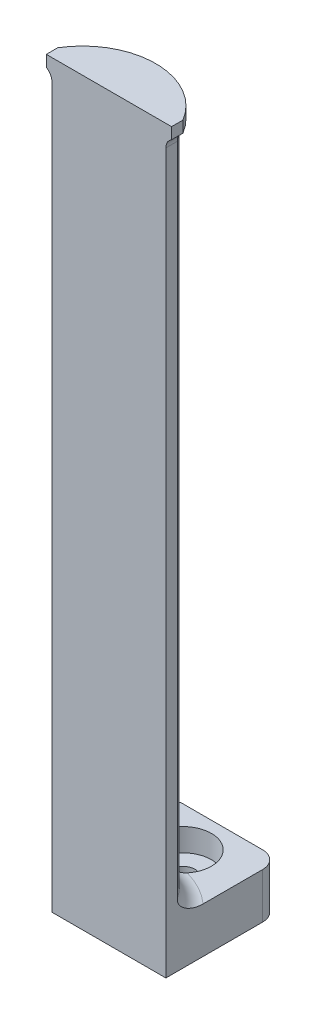
from build123d import *

# Parameters (mm, degrees)
BOSS_EXTRU_1_DEPTH           = 120
ESQUISSE3_W                  = 20
ESQUISSE3_H                  = 18
BOSS_EXTRU_2_DEPTH           = 8
CONG_1_R                     = 3
CONG_2_R                     = 3
ENL_V_MAT_EXTRU_1_DEPTH      = 122.75385005
ENL_V_MAT_EXTRU_1_DEPTH_BACK = 122.75385005
ESQUISSE4_R                  = 2.1
ENL_V_MAT_EXTRU_2_DEPTH      = 122.75385005
ENL_V_MAT_EXTRU_2_DEPTH_BACK = 4
ESQUISSE5_R                  = 5
ESQUISSE7_W                  = 20
ESQUISSE7_H                  = 128
BOSS_EXTRU_3_DEPTH           = 2
BOSS_EXTRU_4_DEPTH           = 2
CONG_3_R                     = 2


with BuildPart() as part:
    # Esquisse2 → Boss.-Extru.1 (new body)
    with BuildSketch(Plane(origin=(0, 0, 0), x_dir=(1, 0, 0), z_dir=(0, 1, 0))):
        with BuildLine():
            Line((-10, 0), (10, 0))
            ThreePointArc((10, 0), (0, 5.366750419), (-10, 0))
        make_face()
    extrude(amount=BOSS_EXTRU_1_DEPTH)

    # Esquisse3 → Boss.-Extru.2 (add)
    with BuildSketch(Plane.XZ):
        with Locations((0, -9)):
            Rectangle(ESQUISSE3_W, ESQUISSE3_H)
    extrude(amount=BOSS_EXTRU_2_DEPTH)

    # Congé1
    cong_1_edges = [part.edges().sort_by_distance(p)[0] for p in [
        (0, 0, -5.366750419),
    ]]
    fillet(cong_1_edges, radius=CONG_1_R)

    # Congé2
    cong_2_edges = [part.edges().sort_by_distance(p)[0] for p in [
        (10, -4, -18),
        (-10, -4, -18),
    ]]
    fillet(cong_2_edges, radius=CONG_2_R)

    # Esquisse4 → Enlèv. mat.-Extru.1 (cut, two sides: drawn at the far end of the back side and taken through both)
    with BuildSketch(Plane(origin=(0, 0, 0), x_dir=(1, 0, 0), z_dir=(0, 1, 0)).offset(-ENL_V_MAT_EXTRU_1_DEPTH_BACK)):
        with Locations(Location((0, 11, 0), (0, 0, 270))):
            Circle(ESQUISSE4_R)
    extrude(amount=ENL_V_MAT_EXTRU_1_DEPTH + ENL_V_MAT_EXTRU_1_DEPTH_BACK, mode=Mode.SUBTRACT)

    # Esquisse5 → Enlèv. mat.-Extru.2 (cut, two sides: drawn at the far end of the back side and taken through both)
    with BuildSketch(Plane(origin=(0, 0, 0), x_dir=(1, 0, 0), z_dir=(0, 1, 0)).offset(-ENL_V_MAT_EXTRU_2_DEPTH_BACK)):
        with Locations(Location((0, 11, 0), (0, 0, 270))):
            Circle(ESQUISSE5_R)
    extrude(amount=ENL_V_MAT_EXTRU_2_DEPTH + ENL_V_MAT_EXTRU_2_DEPTH_BACK, mode=Mode.SUBTRACT)

    # Esquisse7 → Boss.-Extru.3 (add)
    with BuildSketch(Plane.XY):
        with Locations((0, 56)):
            Rectangle(ESQUISSE7_W, ESQUISSE7_H)
    extrude(amount=BOSS_EXTRU_3_DEPTH)

    # Esquisse8 → Boss.-Extru.4 (add)
    with BuildSketch(Plane(origin=(0, 120, 0), x_dir=(1, 0, 0), z_dir=(0, 1, 0))):
        with BuildLine():
            Line((-11, -2), (11, -2))
            Line((11, -2), (11, 0))
            ThreePointArc((11, 0), (0, 6.211982998), (-11, 0))
            Line((-11, 0), (-11, -2))
        make_face()
    extrude(amount=BOSS_EXTRU_4_DEPTH)

    # Congé3
    # the kernel refuses this fillet: 2 mm, written as the material it adds along each edge
    with BuildSketch(Plane(origin=(-10, 120, -4.330127019), x_dir=(-1, 0, 0), z_dir=(0, 0, 1))) as cong_3_piece_1_section:
        with BuildLine():
            CenterArc((2, 1.732050808), CONG_3_R, 180, 60)
            Line((0, 1.732050808), (-0.04, 1.732050808))
            Line((-0.04, 1.732050808), (-0.04, 0))
            Line((-0.04, 0), (0, -0.04))
            ThreePointArc((0, -0.04), (0.5, -0.04), (0.98, -0.034641016))
            Line((0.98, -0.034641016), (1, 0))
        make_face()
    cong_3_piece_1 = extrude(amount=6.330127019, mode=Mode.PRIVATE)
    cong_3_piece_1 = cong_3_piece_1 & Plane(origin=(0, 119.508015578, 6.633249581), x_dir=(0.8333333333333334, 0, -0.5527707983925666), z_dir=(0, -1, 0)) * Cylinder(12, 20, mode=Mode.PRIVATE)
    add(cong_3_piece_1)
    with BuildSketch(Plane(origin=(0, 120, 6.633249581), x_dir=(0.9700709600485506, 0, -0.24282160626781793), z_dir=(0.24282160626781793, 0, 0.9700709600485506))) as cong_3_piece_2_section:
        with BuildLine():
            CenterArc((14, -1.632945866), CONG_3_R, 125.266736396, 54.733263604)
            Line((12, -1.632945866), (11.96, -1.632945866))
            Line((11.96, -1.632945866), (11.96, 0))
            Line((11.96, 0), (12, 0.04))
            ThreePointArc((12, 0.04), (12.422616289, 0.04), (12.82213723, 0.032658917))
            Line((12.82213723, 0.032658917), (12.845232579, 0))
        make_face()
    cong_3_piece_2 = revolve(axis=Axis((0, 120, 6.633249581), (0, 1, 0)), revolution_arc=151.893732209, mode=Mode.PRIVATE)
    cong_3_piece_2 = split(cong_3_piece_2, bisect_by=Plane(origin=(-10, 119.296936372, -5.570265765), z_dir=(1, 0, 0)), keep=Keep.TOP, mode=Mode.PRIVATE)
    cong_3_piece_2 = split(cong_3_piece_2, bisect_by=Plane(origin=(10, 119.296936372, -5.570265765), z_dir=(-1, 0, 0)), keep=Keep.TOP, mode=Mode.PRIVATE)
    add(cong_3_piece_2)
    with BuildSketch(Plane(origin=(10, 120, -4.330127019), x_dir=(1, 0, 0), z_dir=(0, 0, 1))) as cong_3_piece_3_section:
        with BuildLine():
            CenterArc((2, -1.732050808), CONG_3_R, 120, 60)
            Line((0, -1.732050808), (-0.04, -1.732050808))
            Line((-0.04, -1.732050808), (-0.04, 0))
            Line((-0.04, 0), (0, 0.04))
            ThreePointArc((0, 0.04), (0.5, 0.04), (0.98, 0.034641016))
            Line((0.98, 0.034641016), (1, 0))
        make_face()
    cong_3_piece_3 = extrude(amount=6.330127019, mode=Mode.PRIVATE)
    cong_3_piece_3 = cong_3_piece_3 & Plane(origin=(0, 119.508015797, 6.633249581), x_dir=(0.8333333333333334, 0, -0.5527707983925666), z_dir=(0, -1, 0)) * Cylinder(12, 20, mode=Mode.PRIVATE)
    add(cong_3_piece_3)
    with BuildSketch(Plane(origin=(0, 120, 6.633249581), x_dir=(0.9700709600485506, 0, -0.24282160626781793), z_dir=(0.24282160626781793, 0, 0.9700709600485506))) as cong_3_piece_4a_section:
        with BuildLine():
            CenterArc((14, -1.632945866), CONG_3_R, 125.266736396, 54.733263604)
            Line((12, -1.632945866), (11.96, -1.632945866))
            Line((11.96, -1.632945866), (11.96, 0))
            Line((11.96, 0), (12, 0.04))
            ThreePointArc((12, 0.04), (12.422616289, 0.04), (12.82213723, 0.032658917))
            Line((12.82213723, 0.032658917), (12.845232579, 0))
        make_face()
    cong_3_piece_4a = revolve(axis=Axis((0, 120, 6.633249581), (0, 1, 0)), revolution_arc=151.893732209, mode=Mode.PRIVATE)
    cong_3_piece_4a = split(cong_3_piece_4a, bisect_by=Plane(origin=(-11, 119.572175898, 0.48274505), z_dir=(1, 0, 0)), keep=Keep.TOP, mode=Mode.PRIVATE)
    cong_3_piece_4a = split(cong_3_piece_4a, bisect_by=Plane(origin=(-10, 119.572175898, 0.48274505), z_dir=(-1, 0, 0)), keep=Keep.TOP, mode=Mode.PRIVATE)
    with BuildSketch(Plane(origin=(-10, 120, -4.330127019), x_dir=(-1, 0, 0), z_dir=(0, 0, 1))) as cong_3_piece_4b_section:
        with BuildLine():
            CenterArc((2, 1.732050808), CONG_3_R, 180, 60)
            Line((0, 1.732050808), (-0.04, 1.732050808))
            Line((-0.04, 1.732050808), (-0.04, 0))
            Line((-0.04, 0), (0, -0.04))
            ThreePointArc((0, -0.04), (0.5, -0.04), (0.98, -0.034641016))
            Line((0.98, -0.034641016), (1, 0))
        make_face()
    cong_3_piece_4b = extrude(amount=6.330127019, mode=Mode.PRIVATE)
    cong_3_piece_4b = cong_3_piece_4b & Plane(origin=(0, 119.579872147, 6.633249581), x_dir=(0.8563488385776752, 0, -0.5163977794943224), z_dir=(0, -1, 0)) * Cylinder(12.845232579, 20, mode=Mode.PRIVATE)
    cong_3_piece_4b = cong_3_piece_4b - Plane(origin=(0, 119.579872147, 6.633249581), x_dir=(0.8333333333333334, 0, -0.5527707983925666), z_dir=(0, -1, 0)) * Cylinder(12, 20, mode=Mode.PRIVATE)
    cong_3_piece_4 = cong_3_piece_4a & cong_3_piece_4b
    add(cong_3_piece_4)
    with BuildSketch(Plane(origin=(10, 120, -4.330127019), x_dir=(1, 0, 0), z_dir=(0, 0, 1))) as cong_3_piece_5a_section:
        with BuildLine():
            CenterArc((2, -1.732050808), CONG_3_R, 120, 60)
            Line((0, -1.732050808), (-0.04, -1.732050808))
            Line((-0.04, -1.732050808), (-0.04, 0))
            Line((-0.04, 0), (0, 0.04))
            ThreePointArc((0, 0.04), (0.5, 0.04), (0.98, 0.034641016))
            Line((0.98, 0.034641016), (1, 0))
        make_face()
    cong_3_piece_5a = extrude(amount=6.330127019, mode=Mode.PRIVATE)
    cong_3_piece_5a = cong_3_piece_5a & Plane(origin=(0, 119.57987249, 6.633249581), x_dir=(0.8563488385776752, 0, -0.5163977794943224), z_dir=(0, -1, 0)) * Cylinder(12.845232579, 20, mode=Mode.PRIVATE)
    cong_3_piece_5a = cong_3_piece_5a - Plane(origin=(0, 119.57987249, 6.633249581), x_dir=(0.8333333333333334, 0, -0.5527707983925666), z_dir=(0, -1, 0)) * Cylinder(12, 20, mode=Mode.PRIVATE)
    with BuildSketch(Plane(origin=(0, 120, 6.633249581), x_dir=(0.9700709600485506, 0, -0.24282160626781793), z_dir=(0.24282160626781793, 0, 0.9700709600485506))) as cong_3_piece_5b_section:
        with BuildLine():
            CenterArc((14, -1.632945866), CONG_3_R, 125.266736396, 54.733263604)
            Line((12, -1.632945866), (11.96, -1.632945866))
            Line((11.96, -1.632945866), (11.96, 0))
            Line((11.96, 0), (12, 0.04))
            ThreePointArc((12, 0.04), (12.422616289, 0.04), (12.82213723, 0.032658917))
            Line((12.82213723, 0.032658917), (12.845232579, 0))
        make_face()
    cong_3_piece_5b = revolve(axis=Axis((0, 120, 6.633249581), (0, 1, 0)), revolution_arc=151.893732209, mode=Mode.PRIVATE)
    cong_3_piece_5b = split(cong_3_piece_5b, bisect_by=Plane(origin=(11, 119.572175638, 0.482745123), z_dir=(-1, 0, 0)), keep=Keep.TOP, mode=Mode.PRIVATE)
    cong_3_piece_5b = split(cong_3_piece_5b, bisect_by=Plane(origin=(10, 119.572175638, 0.482745123), z_dir=(1, 0, 0)), keep=Keep.TOP, mode=Mode.PRIVATE)
    cong_3_piece_5 = cong_3_piece_5a & cong_3_piece_5b
    add(cong_3_piece_5)


solid = part.part
